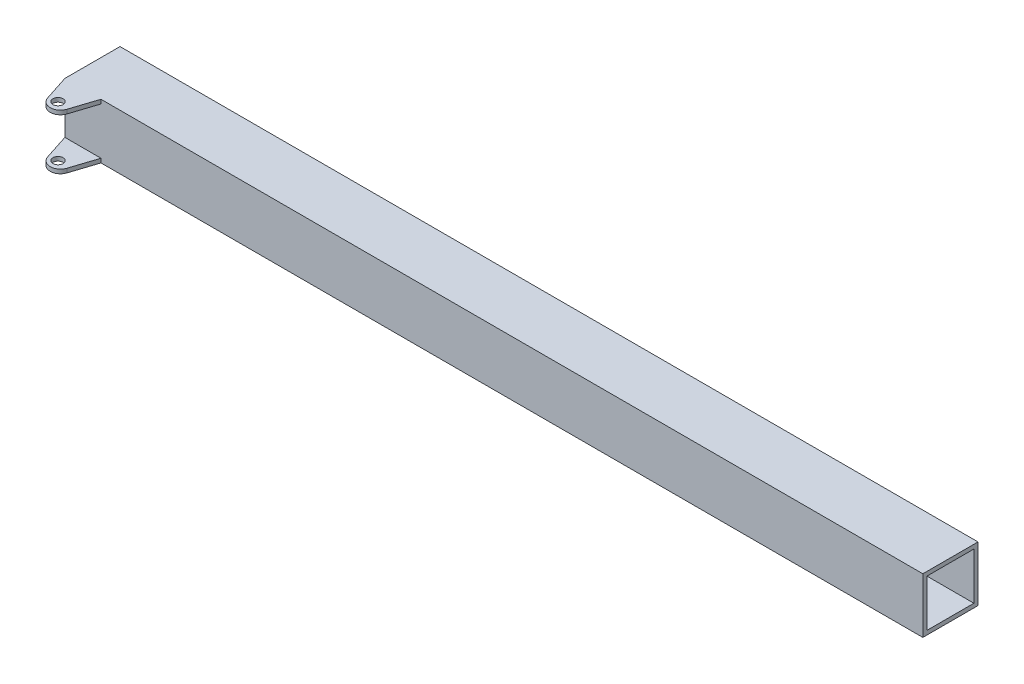
from build123d import *

# Parameters (mm, degrees)
SKETCH1_W           = 270
SKETCH1_H           = 270
SKETCH1_W_2         = 230
SKETCH1_H_2         = 230
BOSS_EXTRUDE1_DEPTH = 4200
BOSS_EXTRUDE2_REACH = 4212.834
SKETCH2_R           = 25
SKETCH3_R           = 24.999999997
BOSS_EXTRUDE3_DEPTH = 20


with BuildPart() as part:
    # Sketch1 → Boss-Extrude1 (new body)
    with BuildSketch(Plane(origin=(0, 0, 0), x_dir=(0, 0, -1), z_dir=(1, 0, 0))):
        with Locations((0, 135)):
            Rectangle(SKETCH1_W, SKETCH1_H)
        with Locations((0, 135)):
            Rectangle(SKETCH1_W_2, SKETCH1_H_2, mode=Mode.SUBTRACT)
    extrude(amount=-BOSS_EXTRUDE1_DEPTH)

    # Sketch2 → Boss-Extrude2 (add, up to next)
    with BuildSketch(Plane.XZ, mode=Mode.PRIVATE) as boss_extrude2_sk1:
        with Locations((-200, 0)):
            Circle(SKETCH2_R)
    boss_extrude2_tool1 = extrude(boss_extrude2_sk1.sketch, amount=-BOSS_EXTRUDE2_REACH, mode=Mode.PRIVATE) - part.part
    add(boss_extrude2_tool1.solids().sort_by_distance((-200, 0, 0))[0])

    # Sketch3 → Boss-Extrude3 (add)
    with BuildSketch(Plane(origin=(0, 0, 0), x_dir=(1, 0, 0), z_dir=(0, 1, 0))):
        with BuildLine():
            Line((-4023.2452538, -135), (-4064.076833276, -260.472475841))
            ThreePointArc((-4064.076833276, -260.472475841), (-4111.6226269, -295), (-4159.168420524, -260.472475841))
            Line((-4159.168420524, -260.472475841), (-4200, -135))
            Line((-4200, -135), (-4023.2452538, -135))
        make_face()
        with Locations((-4118.216524608, -250.296988214)):
            Circle(SKETCH3_R, mode=Mode.SUBTRACT)
    boss_extrude3 = extrude(amount=BOSS_EXTRUDE3_DEPTH)

    # Mirror1: Boss-Extrude3 across plane
    add(boss_extrude3.mirror(Plane(origin=(0, 135, 0), x_dir=(0, 0, 1), z_dir=(0, -1, 0))))


solid = part.part
